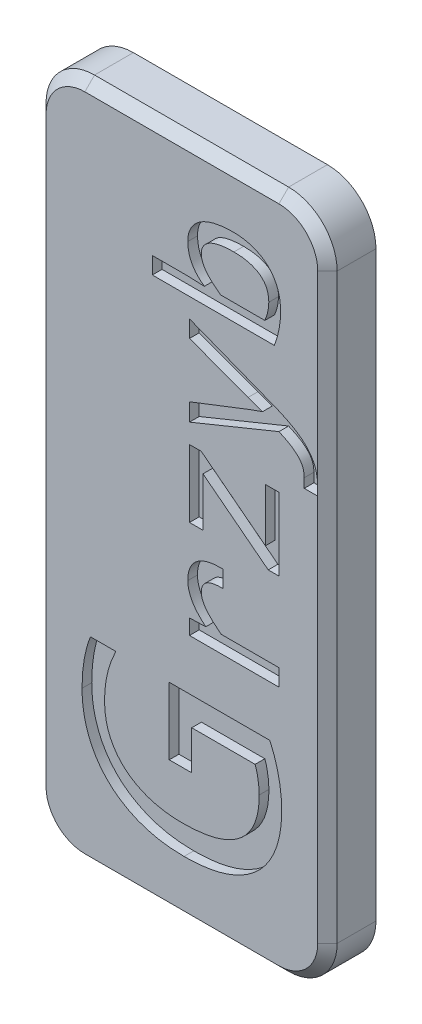
from build123d import *

# Parameters (mm, degrees)
BOSS_EXTRUDE1_START     = -15
BOSS_EXTRUDE1_OUTLINE_W = 70
BOSS_EXTRUDE1_OUTLINE_H = 5
BOSS_EXTRUDE1_DEPTH     = 30
SKETCH5_OUTSIDE_W       = 87.264
SKETCH5_OUTSIDE_H       = 47.264
SKETCH5_OUTSIDE_W_2     = 70
SKETCH5_OUTSIDE_H_2     = 30
CUT_EXTRUDE3_DEPTH      = 1
CUT_EXTRUDE4_DEPTH      = 1
FILLET1_R               = 5
CHAMFER1_SIZE           = 1


# Read off the part's stored shape, not the designer's step: Boss-Extrude1
with BuildPart() as part:
    # Boss-Extrude1 outline → Boss-Extrude1 (new body)
    with BuildSketch(Plane.YZ.offset(BOSS_EXTRUDE1_START)):
        with Locations((0, -2.5)):
            Rectangle(BOSS_EXTRUDE1_OUTLINE_W, BOSS_EXTRUDE1_OUTLINE_H)
    extrude(amount=BOSS_EXTRUDE1_DEPTH)

    # Sketch5 outside → Cut-Extrude3 (cut)
    # profile 1 of 2: a face of its own
    with BuildSketch(Plane(origin=(0, 0, 0), x_dir=(0, 1, 0), z_dir=(0, 0, 1))):
        Rectangle(SKETCH5_OUTSIDE_W, SKETCH5_OUTSIDE_H)
        Rectangle(SKETCH5_OUTSIDE_W_2, SKETCH5_OUTSIDE_H_2, mode=Mode.SUBTRACT)
    # profile 2 of 2: a face of its own
    with BuildSketch(Plane(origin=(0, 0, 0), x_dir=(0, 1, 0), z_dir=(0, 0, 1))):
        with BuildLine():
            add(Edge.make_bspline(
                [(-14.347826087, 6.811594203), (-14.732615494, 6.982736152), (-15.499892443, 7.323996255), (-16.508154186, 7.630289705), (-17.337836868, 7.807183715), (-17.988396432, 7.900945635), (-18.665788779, 7.962175373), (-19.127278599, 7.968039406), (-19.361413043, 7.971014493)],
                knots=[0, 0, 0, 0, 1.45945927, 2.910187841, 3.643322816, 4.400006487, 5.188251666, 6, 6, 6, 6], degree=3))
            add(Edge.make_bspline(
                [(-19.361413043, 7.971014493), (-19.62754591, 7.964589307), (-20.147038723, 7.952047309), (-20.902177535, 7.838822596), (-21.615148708, 7.666721282), (-22.277388662, 7.409852166), (-22.89221388, 7.091992109), (-23.459535362, 6.712942061), (-23.976064693, 6.273438418), (-24.440210023, 5.774954518), (-24.856980667, 5.224592936), (-25.210815809, 4.61249757), (-25.527641138, 3.954429529), (-25.78186254, 3.241644989), (-25.988884577, 2.485307878), (-26.121988108, 1.685262813), (-26.220267689, 0.849344168), (-26.227957646, 0.278089651), (-26.231884058, -0.013586957)],
                knots=[0, 0, 0, 0, 1.073569988, 2.0956145, 3.075462191, 4.028316933, 4.954955511, 5.864200373, 6.776299374, 7.685952519, 8.608514939, 9.556388192, 10.53488969, 11.552674678, 12.606592505, 13.695564134, 14.823379042, 16, 16, 16, 16], degree=3))
            add(Edge.make_bspline(
                [(-26.231884058, -0.013586957), (-26.227686615, -0.317144029), (-26.219531138, -0.906944352), (-26.151962019, -1.769413668), (-26.033175348, -2.580993186), (-25.879207872, -3.347411979), (-25.666786245, -4.058315637), (-25.403711428, -4.715221464), (-25.090850475, -5.31780934), (-24.724854922, -5.864617189), (-24.299129633, -6.349120671), (-23.820015003, -6.773952835), (-23.285280558, -7.137609787), (-22.697352414, -7.445255229), (-22.047459611, -7.678314608), (-21.342238131, -7.85190058), (-20.574871355, -7.949519107), (-20.044050114, -7.963678334), (-19.769021739, -7.971014493)],
                knots=[0, 0, 0, 0, 1.243148344, 2.415391902, 3.539864978, 4.600895424, 5.61417527, 6.574020235, 7.494941044, 8.390096718, 9.261974012, 10.129213218, 11.00555139, 11.904308457, 12.839297802, 13.826028221, 14.87362472, 16, 16, 16, 16], degree=3))
            add(Edge.make_bspline(
                [(-19.769021739, -7.971014493), (-19.667837008, -7.968841211), (-19.4577031, -7.96432788), (-19.134456741, -7.940491334), (-18.800359053, -7.906079371), (-18.464074832, -7.853920118), (-18.132461807, -7.797997232), (-17.813215079, -7.726460779), (-17.518610516, -7.642218147), (-17.333646341, -7.576362005), (-17.246376812, -7.545289855)],
                knots=[0, 0, 0, 0, 0.945101657, 1.962726016, 3.026203458, 4.081046807, 5.14040368, 6.166587829, 7.134962126, 8, 8, 8, 8], degree=3))
            Line((-17.246376812, -7.545289855), (-17.246376812, -1.014492754))
            Line((-17.246376812, -1.014492754), (-21.268115942, -1.014492754))
            Line((-21.268115942, -1.014492754), (-21.268115942, 1.304347826))
            Line((-21.268115942, 1.304347826), (-14.347826087, 1.304347826))
            Line((-14.347826087, 1.304347826), (-14.347826087, -9.0625))
            add(Edge.make_bspline(
                [(-14.347826087, -9.0625), (-14.565623008, -9.158802621), (-15.007965253, -9.354391786), (-15.700028766, -9.60045602), (-16.417186604, -9.811456815), (-17.14989968, -9.988905894), (-17.889471219, -10.124077356), (-18.624470918, -10.216601495), (-19.343695234, -10.280101672), (-19.817201861, -10.286642028), (-20.049818841, -10.289855072)],
                knots=[0, 0, 0, 0, 0.972427008, 1.974984516, 2.997371287, 4.024859125, 5.052920405, 6.066341974, 7.050062525, 8, 8, 8, 8], degree=3))
            add(Edge.make_bspline(
                [(-20.049818841, -10.289855072), (-20.391414924, -10.282574557), (-21.058775345, -10.26835095), (-22.032900107, -10.141286437), (-22.955924255, -9.945825325), (-23.826017978, -9.664187189), (-24.63683275, -9.302774695), (-25.389401893, -8.863310318), (-26.079467457, -8.347002162), (-26.704580794, -7.749417215), (-27.25892709, -7.072242818), (-27.753155857, -6.321822124), (-28.164845777, -5.486453579), (-28.523180657, -4.581398839), (-28.796822979, -3.596062363), (-28.988104597, -2.536249871), (-29.108029701, -1.40370914), (-29.122815668, -0.623801631), (-29.130434783, -0.22192029)],
                knots=[0, 0, 0, 0, 1.063600106, 2.077906186, 3.054673402, 3.998980003, 4.920963561, 5.814580945, 6.708049843, 7.599412522, 8.501355178, 9.428695674, 10.391875437, 11.396983258, 12.456970005, 13.571147305, 14.748427771, 16, 16, 16, 16], degree=3))
            add(Edge.make_bspline(
                [(-29.130434783, -0.22192029), (-29.121625272, 0.178481497), (-29.104389124, 0.961883076), (-28.973402428, 2.103472725), (-28.750457794, 3.1807856), (-28.444475795, 4.191239996), (-28.054699616, 5.133626908), (-27.586223306, 5.998927243), (-27.055212477, 6.797087395), (-26.445274344, 7.513699541), (-25.768915775, 8.155819856), (-25.024354815, 8.715116397), (-24.220353185, 9.199218927), (-23.349461046, 9.592102754), (-22.425414447, 9.903549523), (-21.45097722, 10.132241137), (-20.429311297, 10.263155806), (-19.733156761, 10.280861206), (-19.379528986, 10.289855072)],
                knots=[0, 0, 0, 0, 1.187604435, 2.323594002, 3.403022287, 4.447090083, 5.450927467, 6.422737292, 7.361747858, 8.289531684, 9.208213513, 10.122694231, 11.046633145, 11.986550994, 12.950975564, 13.935151001, 14.951112262, 16, 16, 16, 16], degree=3))
            add(Edge.make_bspline(
                [(-19.379528986, 10.289855072), (-18.92912053, 10.281738158), (-18.048009705, 10.265859457), (-16.963807689, 10.1254234), (-16.12855822, 9.970309924), (-15.520990567, 9.819719976), (-14.926010615, 9.640361859), (-14.540265112, 9.493537132), (-14.347826087, 9.420289855)],
                knots=[0, 0, 0, 0, 1.577605647, 3.086188538, 3.823906723, 4.553997738, 5.27862473, 6, 6, 6, 6], degree=3))
            Line((-14.347826087, 9.420289855), (-14.347826087, 6.811594203))
        make_face()
    extrude(amount=-CUT_EXTRUDE3_DEPTH, mode=Mode.SUBTRACT)

    # Sketch8 → Cut-Extrude4 (cut)
    # profile 1 of 4: a face of its own
    with BuildSketch(Plane.XY):
        with BuildLine():
            Line((-3.043478261, 21.130434783), (9.524456522, 21.130434783))
            add(Edge.make_bspline(
                [(9.524456522, 21.130434783), (9.578448911, 21.271219439), (9.686203193, 21.552187735), (9.820961664, 21.98049503), (9.932820338, 22.411473293), (10.050687664, 22.983353422), (10.151372081, 23.694018178), (10.166476287, 24.263222805), (10.173913043, 24.543478261)],
                knots=[0, 0, 0, 0, 0.129418615, 0.258284737, 0.385214867, 0.511488283, 0.75947477, 1, 1, 1, 1], degree=3))
            add(Edge.make_bspline(
                [(10.173913043, 24.543478261), (10.169727211, 24.716673959), (10.161568027, 25.054273662), (10.098262364, 25.547616586), (9.992407927, 26.013445371), (9.846366699, 26.452936279), (9.65765914, 26.862429373), (9.432632911, 27.241175529), (9.168765653, 27.5873239), (8.868649165, 27.900523235), (8.533131949, 28.182348708), (8.160577688, 28.42644982), (7.756408882, 28.640324523), (7.316175155, 28.816208202), (6.844406083, 28.957641777), (6.340208348, 29.056472629), (5.806968886, 29.121731574), (5.440420316, 29.127487352), (5.252717391, 29.130434783)],
                knots=[0, 0, 0, 0, 0.06826021, 0.133055421, 0.195682322, 0.256318061, 0.315273589, 0.373081483, 0.42964303, 0.48646658, 0.543751595, 0.601983608, 0.66172008, 0.723716767, 0.788562136, 0.855578234, 0.926044213, 1, 1, 1, 1], degree=3))
            add(Edge.make_bspline(
                [(5.252717391, 29.130434783), (5.081488722, 29.127295436), (4.745914247, 29.121142934), (4.254512644, 29.08864917), (3.788795394, 29.020720748), (3.347657452, 28.936650732), (2.93515307, 28.822849914), (2.552586068, 28.68391407), (2.199777279, 28.522406635), (1.881619978, 28.330690317), (1.59224441, 28.118797941), (1.339592873, 27.878738737), (1.11913975, 27.616160161), (0.936400402, 27.328109662), (0.787531911, 27.018083049), (0.68459515, 26.681011006), (0.621051562, 26.321242457), (0.612876296, 26.072733803), (0.608695652, 25.945652174)],
                knots=[0, 0, 0, 0, 0.081139258, 0.159016967, 0.233122269, 0.303989252, 0.371665728, 0.435610284, 0.496666978, 0.555179029, 0.611313497, 0.666260819, 0.719890128, 0.773344004, 0.827479197, 0.882317474, 0.939819854, 1, 1, 1, 1], degree=3))
            add(Edge.make_bspline(
                [(0.608695652, 25.945652174), (0.613536451, 25.798637118), (0.623125217, 25.507426349), (0.695604736, 25.077680598), (0.815871564, 24.661888252), (0.985380737, 24.258207488), (1.21292148, 23.865619489), (1.515470783, 23.493003795), (1.881427835, 23.12889357), (2.163191225, 22.910051389), (2.309782609, 22.796195652)],
                knots=[0, 0, 0, 0, 0.11823502, 0.234202619, 0.349515839, 0.465776136, 0.585634861, 0.713213269, 0.850795152, 1, 1, 1, 1], degree=3))
            Line((2.309782609, 22.796195652), (0.578804348, 22.869565217))
            Line((0.578804348, 22.869565217), (-3.043478261, 22.869565217))
            Line((-3.043478261, 22.869565217), (-3.043478261, 21.130434783))
        make_face()
        with BuildLine():
            Line((8.551630435, 22.869565217), (3.980978261, 22.869565217))
            add(Edge.make_bspline(
                [(3.980978261, 22.869565217), (3.890689474, 22.935802406), (3.715180233, 23.064558578), (3.470926702, 23.264164999), (3.24217474, 23.449745532), (2.9828929, 23.690157863), (2.704986189, 23.975887425), (2.433058488, 24.313317903), (2.228915764, 24.634800983), (2.095958261, 24.949504118), (2.014175707, 25.255725881), (2.004667307, 25.459672885), (2, 25.559782609)],
                knots=[0, 0, 0, 0, 0.09701008, 0.188574528, 0.27328962, 0.352168096, 0.49482675, 0.618261153, 0.727165955, 0.82352615, 0.913375789, 1, 1, 1, 1], degree=3))
            add(Edge.make_bspline(
                [(2, 25.559782609), (2.00327956, 25.636987783), (2.009706854, 25.788294762), (2.055671567, 26.007171849), (2.135845725, 26.208764405), (2.246982588, 26.39248196), (2.382431954, 26.561563058), (2.546310986, 26.711783906), (2.731639992, 26.848470627), (2.942003067, 26.967458486), (3.174730461, 27.069975596), (3.428591781, 27.160747401), (3.706398176, 27.232330282), (4.113813021, 27.313098311), (4.668193946, 27.380013713), (5.123876064, 27.387435523), (5.361413043, 27.391304348)],
                knots=[0, 0, 0, 0, 0.054296817, 0.106411098, 0.156462786, 0.206184849, 0.256937384, 0.308333841, 0.362115984, 0.418626011, 0.47795414, 0.540833923, 0.608066887, 0.679547045, 0.832954983, 1, 1, 1, 1], degree=3))
            add(Edge.make_bspline(
                [(5.361413043, 27.391304348), (5.524531002, 27.388823328), (5.837732464, 27.384059542), (6.287652765, 27.344573747), (6.696193572, 27.27360412), (7.066026906, 27.180223241), (7.395532705, 27.058718799), (7.692950247, 26.924088818), (7.954828724, 26.766514332), (8.182713841, 26.589004933), (8.376233676, 26.393394235), (8.545472134, 26.187468009), (8.67767135, 25.961372863), (8.785850277, 25.725128648), (8.857703751, 25.476735826), (8.918305157, 25.22438378), (8.949875604, 24.964576327), (8.954303807, 24.789017992), (8.956521739, 24.701086957)],
                knots=[0, 0, 0, 0, 0.096040522, 0.184406623, 0.265602459, 0.339985567, 0.408655637, 0.472131334, 0.531952495, 0.588180117, 0.641733618, 0.693710202, 0.74465865, 0.795509294, 0.846289963, 0.896620491, 0.948220816, 1, 1, 1, 1], degree=3))
            add(Edge.make_bspline(
                [(8.956521739, 24.701086957), (8.950711379, 24.554043235), (8.938727397, 24.250762687), (8.856796627, 23.791664913), (8.726497921, 23.327056596), (8.610176373, 23.022734125), (8.551630435, 22.869565217)],
                knots=[0, 0, 0, 0, 0.233776254, 0.482168091, 0.739369401, 1, 1, 1, 1], degree=3))
        make_face(mode=Mode.SUBTRACT)
    # profile 2 of 4: a face of its own
    with BuildSketch(Plane.XY):
        with BuildLine():
            Line((14, 9.913043478), (14, 10.769021739))
            add(Edge.make_bspline(
                [(14, 10.769021739), (13.99759752, 10.917777627), (13.99290711, 11.208196746), (13.934939855, 11.632414532), (13.850632258, 12.035186586), (13.726631501, 12.417679346), (13.565802898, 12.781727744), (13.362672663, 13.12997704), (13.116592272, 13.460723637), (12.831793444, 13.779097502), (12.502747666, 14.079829038), (12.135177983, 14.372032103), (11.722236486, 14.64851738), (11.266797494, 14.914607349), (10.766675074, 15.172105254), (10.223182859, 15.427580478), (9.633735721, 15.677171004), (9.222467854, 15.832913563), (9.010869565, 15.913043478)],
                knots=[0, 0, 0, 0, 0.057743725, 0.112734239, 0.166012934, 0.217420702, 0.2686161, 0.320334803, 0.373678523, 0.428496535, 0.486013617, 0.546625606, 0.610742465, 0.678873595, 0.751423438, 0.829180624, 0.912113027, 1, 1, 1, 1], degree=3))
            Line((9.010869565, 15.913043478), (0.782608696, 19.130434783))
            Line((0.782608696, 19.130434783), (0.782608696, 17.377717391))
            Line((0.782608696, 17.377717391), (6.842391304, 15.157608696))
            Line((6.842391304, 15.157608696), (8.309782609, 14.608695652))
            Line((8.309782609, 14.608695652), (6.964673913, 14.127717391))
            Line((6.964673913, 14.127717391), (0.782608696, 11.72826087))
            Line((0.782608696, 11.72826087), (0.782608696, 9.913043478))
            Line((0.782608696, 9.913043478), (10, 13.673913043))
            add(Edge.make_bspline(
                [(10, 13.673913043), (10.11344187, 13.624604022), (10.333525114, 13.528941905), (10.650016677, 13.381452565), (10.937386048, 13.224740807), (11.202050894, 13.071697816), (11.440566209, 12.91264995), (11.655007398, 12.750518015), (11.846374153, 12.584071727), (12.015143294, 12.415183222), (12.165303594, 12.244365847), (12.285728738, 12.06307912), (12.392208909, 11.880418859), (12.499572077, 11.626261726), (12.589181371, 11.285715093), (12.602084274, 11.005165262), (12.608695652, 10.861413043)],
                knots=[0, 0, 0, 0, 0.09058816, 0.175745835, 0.255580456, 0.330210649, 0.399569469, 0.465373369, 0.52696346, 0.585125376, 0.640166081, 0.693153943, 0.744247859, 0.794765843, 0.894839127, 1, 1, 1, 1], degree=3))
            Line((12.608695652, 10.861413043), (12.608695652, 9.913043478))
            Line((12.608695652, 9.913043478), (14, 9.913043478))
        make_face()
    # profile 3 of 4: a face of its own
    with BuildSketch(Plane.XY):
        Polygon((8.89673913, 0.782608696), (10, 0.782608696), (10, 8.260869565), (8.608695652, 8.260869565), (8.608695652, 2.79076087), (1.994565217, 7.913043478), (0.782608696, 7.913043478), (0.782608696, 0.956521739), (2.173913043, 0.956521739), (2.173913043, 5.994565217), align=None)
    # profile 4 of 4: a face of its own
    with BuildSketch(Plane.XY):
        with BuildLine():
            Line((10, -7.391304348), (4.043478261, -7.391304348))
            add(Edge.make_bspline(
                [(4.043478261, -7.391304348), (3.955436173, -7.32178868), (3.784563281, -7.186872032), (3.539068434, -6.986913089), (3.31687742, -6.790220395), (3.051187651, -6.547849471), (2.765283232, -6.256018139), (2.477611863, -5.914993585), (2.255192323, -5.587970192), (2.110373724, -5.263205109), (2.015077672, -4.946589223), (2.00495472, -4.734327264), (2, -4.630434783)],
                knots=[0, 0, 0, 0, 0.094835715, 0.184058027, 0.267619669, 0.345658673, 0.488073943, 0.612590325, 0.722605584, 0.820962115, 0.912369177, 1, 1, 1, 1], degree=3))
            add(Edge.make_bspline(
                [(2, -4.630434783), (2.001572892, -4.573308651), (2.004634163, -4.462125839), (2.028198763, -4.300077585), (2.074119047, -4.149992286), (2.128297998, -4.007152454), (2.207797849, -3.87843025), (2.298649297, -3.757899286), (2.410655105, -3.651717887), (2.535164425, -3.552090194), (2.682287227, -3.467800188), (2.848430659, -3.39531261), (3.033667725, -3.332576639), (3.239260453, -3.283819387), (3.465693296, -3.249991048), (3.71232561, -3.225127174), (3.979994818, -3.21521323), (4.164853796, -3.216646739), (4.260869565, -3.217391304)],
                knots=[0, 0, 0, 0, 0.056451502, 0.109869803, 0.161137785, 0.211331973, 0.260298181, 0.310067633, 0.360069934, 0.412351384, 0.467307216, 0.527013923, 0.59126393, 0.660298257, 0.735492387, 0.817338525, 0.905125614, 1, 1, 1, 1], degree=3))
            Line((4.260869565, -3.217391304), (4.260869565, -1.47826087))
            add(Edge.make_bspline(
                [(4.260869565, -1.47826087), (4.114122347, -1.476761083), (3.830400393, -1.473861388), (3.418049322, -1.494097469), (3.033950595, -1.543214716), (2.677382355, -1.615280275), (2.348857875, -1.713150155), (2.048080811, -1.83526168), (1.774282161, -1.982284137), (1.528873263, -2.153659767), (1.310898959, -2.348369256), (1.124145073, -2.567270001), (0.960748685, -2.8040699), (0.832945582, -3.066813145), (0.733237348, -3.349719216), (0.659348845, -3.653582998), (0.615369581, -3.978776903), (0.610962067, -4.202759381), (0.608695652, -4.317934783)],
                knots=[0, 0, 0, 0, 0.083012518, 0.160496901, 0.233334899, 0.301873265, 0.366071497, 0.42697227, 0.485208411, 0.541502685, 0.59593059, 0.650065838, 0.703931216, 0.758243215, 0.814807375, 0.873344829, 0.934871869, 1, 1, 1, 1], degree=3))
            add(Edge.make_bspline(
                [(0.608695652, -4.317934783), (0.614076317, -4.451468909), (0.624935892, -4.720975339), (0.70975035, -5.123547404), (0.851166297, -5.523151641), (1.045967075, -5.923148932), (1.301687735, -6.322726702), (1.624869426, -6.721769219), (2.014205155, -7.12347718), (2.308592402, -7.378179647), (2.461956522, -7.510869565)],
                knots=[0, 0, 0, 0, 0.104929684, 0.211775263, 0.321911898, 0.437530162, 0.560808167, 0.694050889, 0.840612606, 1, 1, 1, 1], degree=3))
            Line((2.461956522, -7.510869565), (0.782608696, -7.559782609))
            Line((0.782608696, -7.559782609), (0.782608696, -9.130434783))
            Line((0.782608696, -9.130434783), (10, -9.130434783))
            Line((10, -9.130434783), (10, -7.391304348))
        make_face()
    extrude(amount=-CUT_EXTRUDE4_DEPTH, mode=Mode.SUBTRACT)

    # Fillet1
    fillet1_edges = [part.edges().sort_by_distance(p)[0] for p in [
        (15, 35, -2.5),
        (-15, 35, -2.5),
        (-15, -35, -2.5),
        (15, -35, -2.5),
    ]]
    fillet(fillet1_edges, radius=FILLET1_R)

    # Chamfer1
    chamfer1_edges = [part.edges().sort_by_distance(p)[0] for p in [
        (0, 35, 0),
        (15, 0, 0),
        (-15, 0, 0),
        (0, -35, 0),
        (-13.535533906, -33.535533906, 0),
        (13.535533906, -33.535533906, 0),
        (13.535533906, 33.535533906, 0),
        (-13.535533906, 33.535533906, 0),
    ]]
    chamfer(chamfer1_edges, length=CHAMFER1_SIZE - 0.0001)  # a hair under: the kernel refuses the full size


solid = part.part
